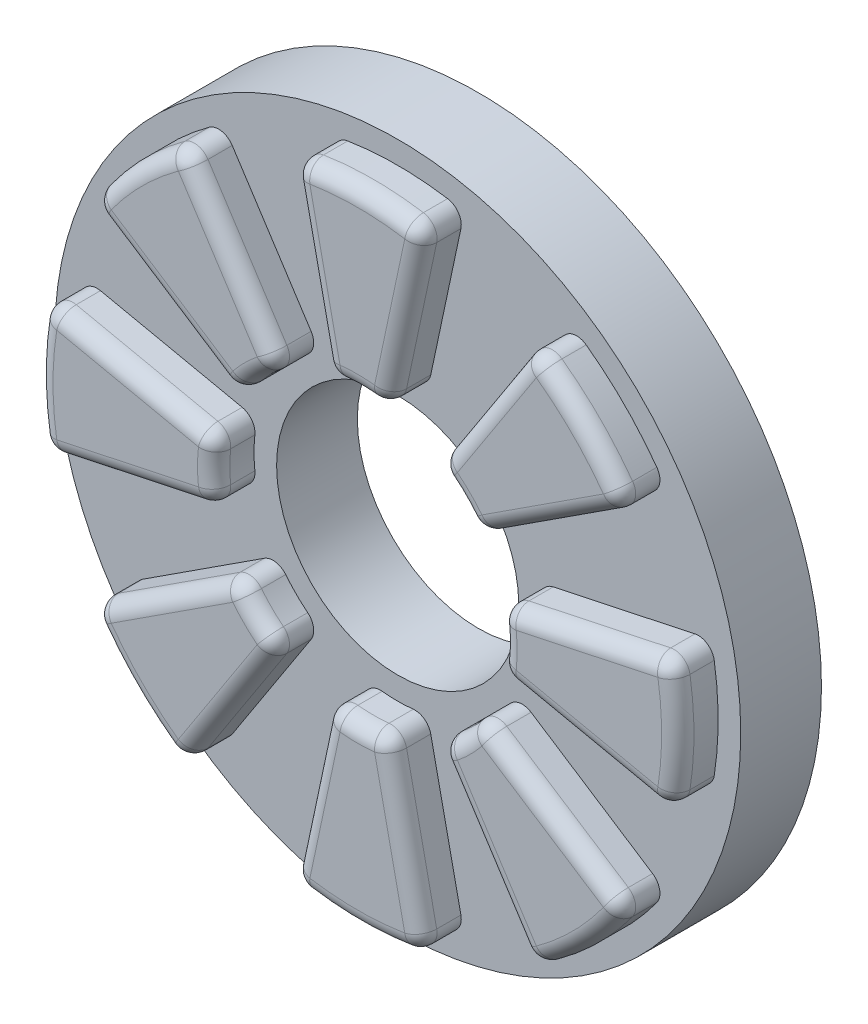
from build123d import *

# Parameters (mm, degrees)
SKETCH1_R           = 26.9875
SKETCH1_R_2         = 9.525
BOSS_EXTRUDE1_DEPTH = 6.35
BOSS_EXTRUDE2_DEPTH = 3.175
FILLET1_R           = 1.27
FILLET2_R           = 1.27


with BuildPart() as part:
    # Sketch1 → Boss-Extrude1 (new body)
    with BuildSketch(Plane.XY):
        Circle(SKETCH1_R)
        Circle(SKETCH1_R_2, mode=Mode.SUBTRACT)
    extrude(amount=BOSS_EXTRUDE1_DEPTH)

    # Sketch3 → Boss-Extrude2 (add)
    with BuildSketch(Plane.XY.offset(6.35)):
        with BuildLine():
            Line((-5.245254895, 24.657781557), (-2.351776754, 11.055630018))
            ThreePointArc((-2.351776754, 11.055630018), (0, 11.303), (2.351776754, 11.055630018))
            Line((2.351776754, 11.055630018), (5.245254895, 24.657781557))
            ThreePointArc((5.245254895, 24.657781557), (0, 25.2095), (-5.245254895, 24.657781557))
        make_face()
        with BuildLine():
            Line((9.480468247, 6.154553666), (21.144639854, 13.726729243))
            ThreePointArc((21.144639854, 13.726729243), (17.8258084, 17.8258084), (13.726729243, 21.144639854))
            Line((13.726729243, 21.144639854), (6.154553666, 9.480468247))
            ThreePointArc((6.154553666, 9.480468247), (7.992427948, 7.992427948), (9.480468247, 6.154553666))
        make_face()
        with BuildLine():
            Line((11.055630018, -2.351776754), (24.657781557, -5.245254895))
            ThreePointArc((24.657781557, -5.245254895), (25.2095, 0), (24.657781557, 5.245254895))
            Line((24.657781557, 5.245254895), (11.055630018, 2.351776754))
            ThreePointArc((11.055630018, 2.351776754), (11.303, 0), (11.055630018, -2.351776754))
        make_face()
        with BuildLine():
            Line((6.154553666, -9.480468247), (13.726729243, -21.144639854))
            ThreePointArc((13.726729243, -21.144639854), (17.8258084, -17.8258084), (21.144639854, -13.726729243))
            Line((21.144639854, -13.726729243), (9.480468247, -6.154553666))
            ThreePointArc((9.480468247, -6.154553666), (7.992427948, -7.992427948), (6.154553666, -9.480468247))
        make_face()
        with BuildLine():
            Line((-2.351776754, -11.055630018), (-5.245254895, -24.657781557))
            ThreePointArc((-5.245254895, -24.657781557), (0, -25.2095), (5.245254895, -24.657781557))
            Line((5.245254895, -24.657781557), (2.351776754, -11.055630018))
            ThreePointArc((2.351776754, -11.055630018), (0, -11.303), (-2.351776754, -11.055630018))
        make_face()
        with BuildLine():
            Line((-9.480468247, -6.154553666), (-21.144639854, -13.726729243))
            ThreePointArc((-21.144639854, -13.726729243), (-17.8258084, -17.8258084), (-13.726729243, -21.144639854))
            Line((-13.726729243, -21.144639854), (-6.154553666, -9.480468247))
            ThreePointArc((-6.154553666, -9.480468247), (-7.992427948, -7.992427948), (-9.480468247, -6.154553666))
        make_face()
        with BuildLine():
            Line((-11.055630018, 2.351776754), (-24.657781557, 5.245254895))
            ThreePointArc((-24.657781557, 5.245254895), (-25.2095, 0), (-24.657781557, -5.245254895))
            Line((-24.657781557, -5.245254895), (-11.055630018, -2.351776754))
            ThreePointArc((-11.055630018, -2.351776754), (-11.303, 0), (-11.055630018, 2.351776754))
        make_face()
        with BuildLine():
            Line((-6.154553666, 9.480468247), (-13.726729243, 21.144639854))
            ThreePointArc((-13.726729243, 21.144639854), (-17.8258084, 17.8258084), (-21.144639854, 13.726729243))
            Line((-21.144639854, 13.726729243), (-9.480468247, 6.154553666))
            ThreePointArc((-9.480468247, 6.154553666), (-7.992427948, 7.992427948), (-6.154553666, 9.480468247))
        make_face()
    extrude(amount=BOSS_EXTRUDE2_DEPTH)

    # Fillet1
    fillet1_edges = [part.edges().sort_by_distance(p)[0] for p in [
        (-24.657781557, 5.245254895, 7.9375),
        (21.144639854, -13.726729243, 7.9375),
        (24.657781557, 5.245254895, 7.9375),
        (9.480468247, -6.154553666, 7.9375),
        (2.351776754, -11.055630018, 7.9375),
        (-6.154553666, -9.480468247, 7.9375),
        (-9.480468247, -6.154553666, 7.9375),
        (-11.055630018, 2.351776754, 7.9375),
        (11.055630018, -2.351776754, 7.9375),
        (24.657781557, -5.245254895, 7.9375),
        (5.245254895, -24.657781557, 7.9375),
        (-24.657781557, -5.245254895, 7.9375),
        (-11.055630018, -2.351776754, 7.9375),
        (-21.144639854, -13.726729243, 7.9375),
        (-13.726729243, -21.144639854, 7.9375),
        (-2.351776754, -11.055630018, 7.9375),
        (-5.245254895, -24.657781557, 7.9375),
        (13.726729243, -21.144639854, 7.9375),
        (6.154553666, -9.480468247, 7.9375),
        (9.480468247, 6.154553666, 7.9375),
        (11.055630018, 2.351776754, 7.9375),
        (6.154553666, 9.480468247, 7.9375),
        (21.144639854, 13.726729243, 7.9375),
        (13.726729243, 21.144639854, 7.9375),
        (-5.245254895, 24.657781557, 7.9375),
        (5.245254895, 24.657781557, 7.9375),
        (2.351776754, 11.055630018, 7.9375),
        (-2.351776754, 11.055630018, 7.9375),
        (-9.480468247, 6.154553666, 7.9375),
        (-6.154553666, 9.480468247, 7.9375),
        (-13.726729243, 21.144639854, 7.9375),
        (-21.144639854, 13.726729243, 7.9375),
    ]]
    fillet(fillet1_edges, radius=FILLET1_R)

    # Fillet2
    fillet2_edges = [part.edges().sort_by_distance(p)[0] for p in [
        (-4.778287459, -24.366392101, 9.525),
        (-3.788318834, -17.80877005, 9.525),
        (-2.104941883, -11.470293616, 9.525),
        (0, -11.303, 9.525),
        (2.104941883, -11.470293616, 9.525),
        (3.788318834, -17.80877005, 9.525),
        (4.778287459, -24.366392101, 9.525),
        (0, -25.2095, 9.525),
        (-13.850881624, -20.608400552, 9.525),
        (-17.8258084, -17.8258084, 9.525),
        (-20.608400552, -13.850881624, 9.525),
        (-15.271448004, -9.91395613, 9.525),
        (-9.599141078, -6.622303719, 9.525),
        (-7.992427948, -7.992427948, 9.525),
        (-6.622303719, -9.599141078, 9.525),
        (13.850881624, -20.608400552, 9.525),
        (9.91395613, -15.271448004, 9.525),
        (6.622303719, -9.599141078, 9.525),
        (7.992427948, -7.992427948, 9.525),
        (9.599141078, -6.622303719, 9.525),
        (15.271448004, -9.91395613, 9.525),
        (20.608400552, -13.850881624, 9.525),
        (17.8258084, -17.8258084, 9.525),
        (24.366392101, -4.778287459, 9.525),
        (17.80877005, -3.788318834, 9.525),
        (11.470293616, -2.104941883, 9.525),
        (11.303, 0, 9.525),
        (11.470293616, 2.104941883, 9.525),
        (17.80877005, 3.788318834, 9.525),
        (24.366392101, 4.778287459, 9.525),
        (25.2095, 0, 9.525),
        (6.622303719, 9.599141078, 9.525),
        (9.91395613, 15.271448004, 9.525),
        (13.850881624, 20.608400552, 9.525),
        (17.8258084, 17.8258084, 9.525),
        (20.608400552, 13.850881624, 9.525),
        (15.271448004, 9.91395613, 9.525),
        (9.599141078, 6.622303719, 9.525),
        (7.992427948, 7.992427948, 9.525),
        (4.778287459, 24.366392101, 9.525),
        (3.788318834, 17.80877005, 9.525),
        (2.104941883, 11.470293616, 9.525),
        (0, 11.303, 9.525),
        (-2.104941883, 11.470293616, 9.525),
        (-3.788318834, 17.80877005, 9.525),
        (-4.778287459, 24.366392101, 9.525),
        (0, 25.2095, 9.525),
        (-20.608400552, 13.850881624, 9.525),
        (-17.8258084, 17.8258084, 9.525),
        (-13.850881624, 20.608400552, 9.525),
        (-9.91395613, 15.271448004, 9.525),
        (-6.622303719, 9.599141078, 9.525),
        (-7.992427948, 7.992427948, 9.525),
        (-9.599141078, 6.622303719, 9.525),
        (-15.271448004, 9.91395613, 9.525),
        (-11.470293616, 2.104941883, 9.525),
        (-11.303, 0, 9.525),
        (-11.470293616, -2.104941883, 9.525),
        (-17.80877005, -3.788318834, 9.525),
        (-24.366392101, -4.778287459, 9.525),
        (-25.2095, 0, 9.525),
        (-24.366392101, 4.778287459, 9.525),
        (-17.80877005, 3.788318834, 9.525),
        (-9.91395613, -15.271448004, 9.525),
    ]]
    fillet(fillet2_edges, radius=FILLET2_R)


solid = part.part
